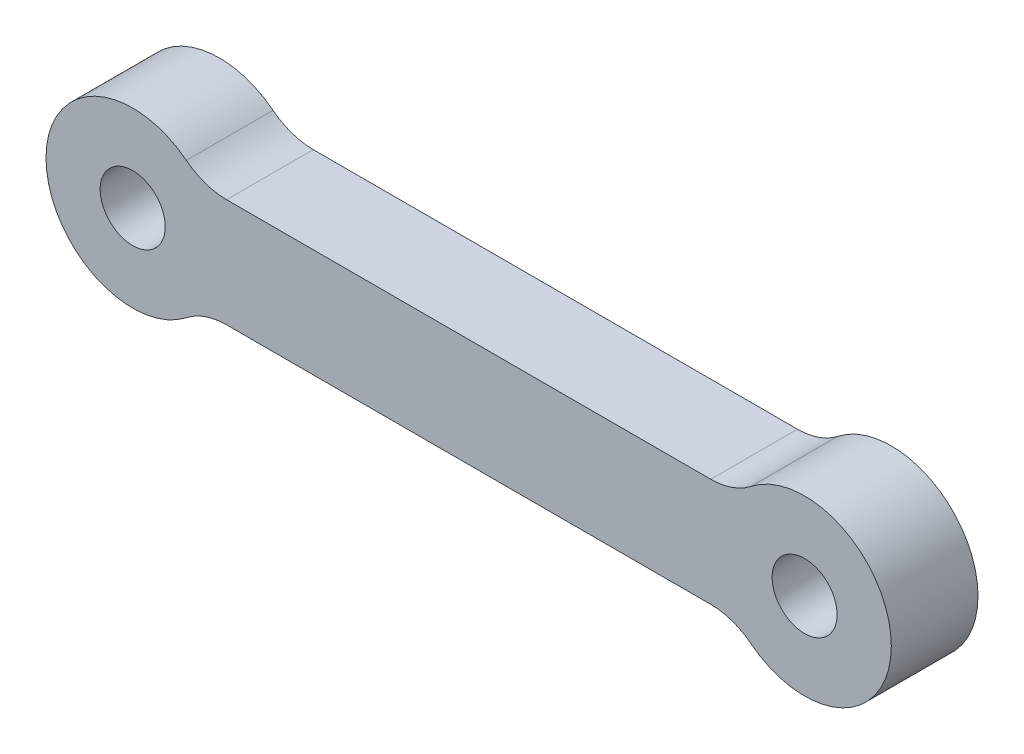
from build123d import *

# Parameters (mm, degrees)
SKETCH1_R           = 1.5
BOSS_EXTRUDE1_DEPTH = 4


with BuildPart() as part:
    # Sketch1 → Boss-Extrude1 (new body)
    with BuildSketch(Plane.XY):
        with BuildLine():
            Line((-11.169872981, 2.5), (11.169872981, 2.5))
            ThreePointArc((11.169872981, 2.5), (12.151853487, 2.665266452), (13.025641703, 3.142857143))
            ThreePointArc((13.025641703, 3.142857143), (19.5, 0), (13.025641703, -3.142857143))
            ThreePointArc((13.025641703, -3.142857143), (12.151853487, -2.665266452), (11.169872981, -2.5))
            Line((11.169872981, -2.5), (-11.169872981, -2.5))
            ThreePointArc((-11.169872981, -2.5), (-12.151853487, -2.665266452), (-13.025641703, -3.142857143))
            ThreePointArc((-13.025641703, -3.142857143), (-19.5, 0), (-13.025641703, 3.142857143))
            ThreePointArc((-13.025641703, 3.142857143), (-12.151853487, 2.665266452), (-11.169872981, 2.5))
        make_face()
        with Locations((-15.5, 0)):
            Circle(SKETCH1_R, mode=Mode.SUBTRACT)
        with Locations((15.5, 0)):
            Circle(SKETCH1_R, mode=Mode.SUBTRACT)
    extrude(amount=BOSS_EXTRUDE1_DEPTH)


solid = part.part
